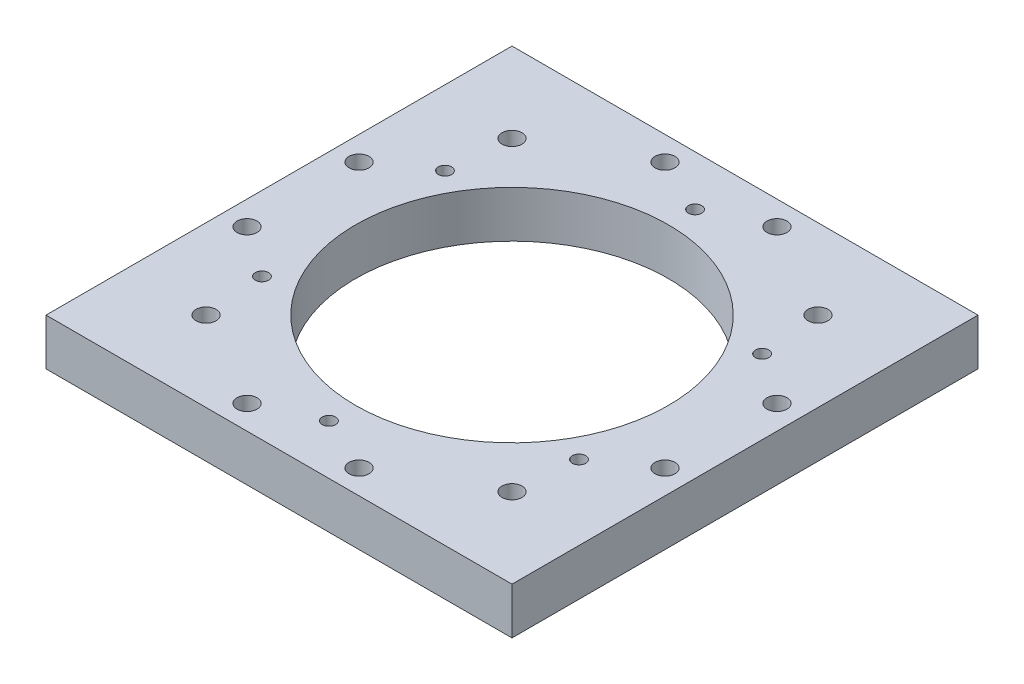
from build123d import *

# Parameters (mm, degrees)
SKETCH1_W           = 70
SKETCH1_H           = 70
SKETCH1_R           = 23.5
SKETCH1_R_2         = 1
SKETCH1_R_3         = 1.5
BOSS_EXTRUDE1_DEPTH = 7


with BuildPart() as part:
    # Sketch1 → Boss-Extrude1 (new body)
    with BuildSketch(Plane(origin=(0, 0, 0), x_dir=(1, 0, 0), z_dir=(0, 1, 0))):
        Rectangle(SKETCH1_W, SKETCH1_H)
        Circle(SKETCH1_R, mode=Mode.SUBTRACT)
        with Locations((0, 27.5)):
            Circle(SKETCH1_R_2, mode=Mode.SUBTRACT)
        with Locations((23.815698604, 13.75)):
            Circle(SKETCH1_R_2, mode=Mode.SUBTRACT)
        with Locations((23.815698604, -13.75)):
            Circle(SKETCH1_R_2, mode=Mode.SUBTRACT)
        with Locations((0, -27.5)):
            Circle(SKETCH1_R_2, mode=Mode.SUBTRACT)
        with Locations((-23.815698604, -13.75)):
            Circle(SKETCH1_R_2, mode=Mode.SUBTRACT)
        with Locations((-23.815698604, 13.75)):
            Circle(SKETCH1_R_2, mode=Mode.SUBTRACT)
        with Locations((-31.392589354, -8.411618966)):
            Circle(SKETCH1_R_3, mode=Mode.SUBTRACT)
        with Locations((-31.392589354, 8.411618966)):
            Circle(SKETCH1_R_3, mode=Mode.SUBTRACT)
        with Locations((-22.980970389, 22.980970389)):
            Circle(SKETCH1_R_3, mode=Mode.SUBTRACT)
        with Locations((-8.411618966, 31.392589354)):
            Circle(SKETCH1_R_3, mode=Mode.SUBTRACT)
        with Locations((8.411618966, 31.392589354)):
            Circle(SKETCH1_R_3, mode=Mode.SUBTRACT)
        with Locations((22.980970389, 22.980970389)):
            Circle(SKETCH1_R_3, mode=Mode.SUBTRACT)
        with Locations((31.392589354, 8.411618966)):
            Circle(SKETCH1_R_3, mode=Mode.SUBTRACT)
        with Locations((31.392589354, -8.411618966)):
            Circle(SKETCH1_R_3, mode=Mode.SUBTRACT)
        with Locations((22.980970389, -22.980970389)):
            Circle(SKETCH1_R_3, mode=Mode.SUBTRACT)
        with Locations((8.411618966, -31.392589354)):
            Circle(SKETCH1_R_3, mode=Mode.SUBTRACT)
        with Locations((-8.411618966, -31.392589354)):
            Circle(SKETCH1_R_3, mode=Mode.SUBTRACT)
        with Locations((-22.980970389, -22.980970389)):
            Circle(SKETCH1_R_3, mode=Mode.SUBTRACT)
    extrude(amount=BOSS_EXTRUDE1_DEPTH)


solid = part.part
